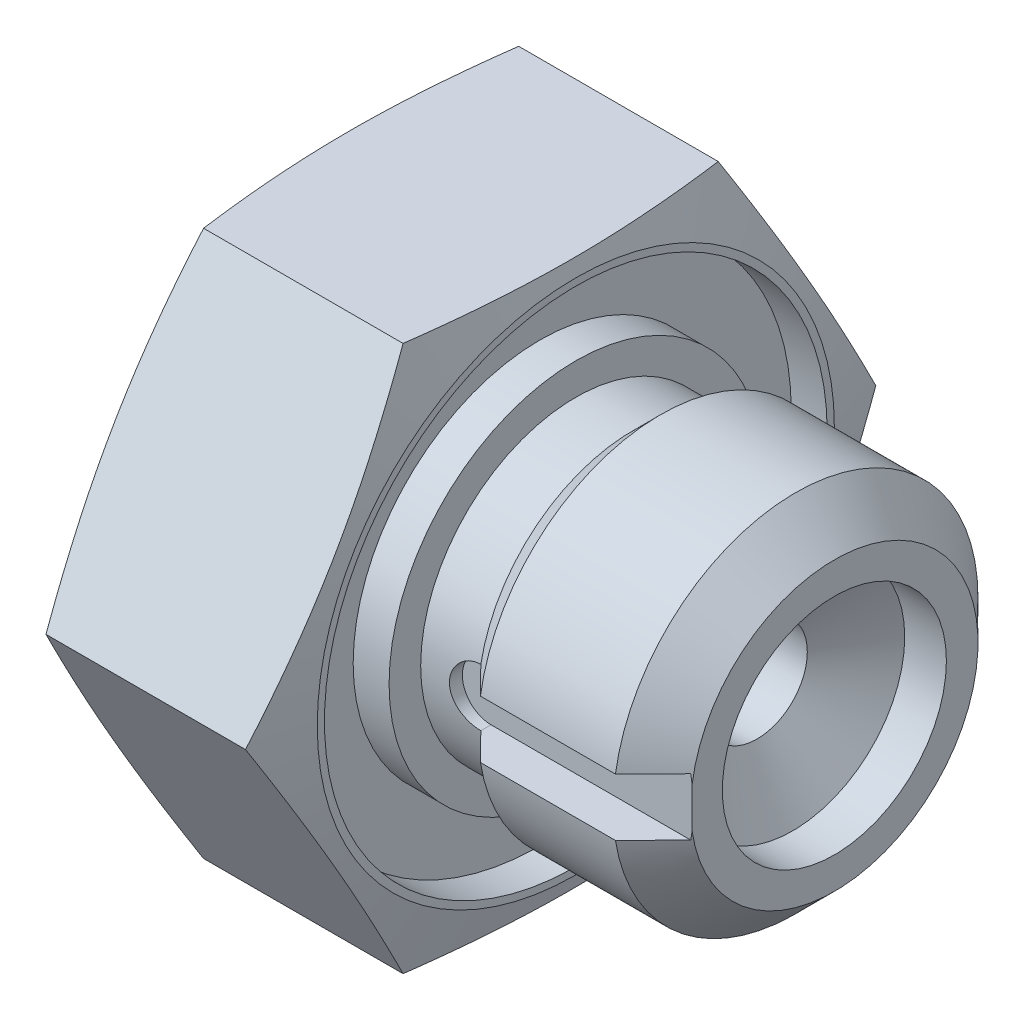
from build123d import *

# Parameters (mm, degrees)
SKETCH2_OUTSIDE_W  = 41.142
SKETCH2_OUTSIDE_H  = 41.142
CUT_EXTRUDE1_DEPTH = 28.184554438
CUT_EXTRUDE3_DEPTH = 10


with BuildPart() as part:
    # Sketch1 → Revolve1 (revolve)
    with BuildSketch(Plane.XY):
        Polygon((0, 3.9), (0, 5), (-1.35, 6.35), (-6.05, 6.35), (-7, 5.4), (-9, 5.4), (-9, 6.5), (-10.25, 6.5), (-10.25, 8.75), (-9, 8.75), (-9, 9), (-10.607695155, 15), (-15.392304845, 15), (-17, 9), (-17, 1.75), (-2.691303079, 1.75), (-1.45, 3.9), align=None)
    revolve(axis=Axis((0, 0, 0), (-1, 0, 0)))

    # Sketch2 outside → Cut-Extrude1 (cut, through all)
    with BuildSketch(Plane.ZY.offset(17)):
        Rectangle(SKETCH2_OUTSIDE_W, SKETCH2_OUTSIDE_H)
        Polygon((10.969655115, 0), (5.484827557, 9.5), (-5.484827557, 9.5), (-10.969655115, 0), (-5.484827557, -9.5), (5.484827557, -9.5), align=None, mode=Mode.SUBTRACT)
    extrude(amount=-CUT_EXTRUDE1_DEPTH, mode=Mode.SUBTRACT)

    # Sketch3 → Cut-Extrude3 (cut)
    with BuildSketch(Plane.XY.offset(4.95)):
        with BuildLine():
            Line((0, 1), (-7, 1))
            ThreePointArc((-7, 1), (-8, 0), (-7, -1))
            Line((-7, -1), (0, -1))
            Line((0, -1), (0, 0))
            Line((0, 0), (0, 1))
        make_face()
    extrude(amount=CUT_EXTRUDE3_DEPTH, mode=Mode.SUBTRACT)


solid = part.part
